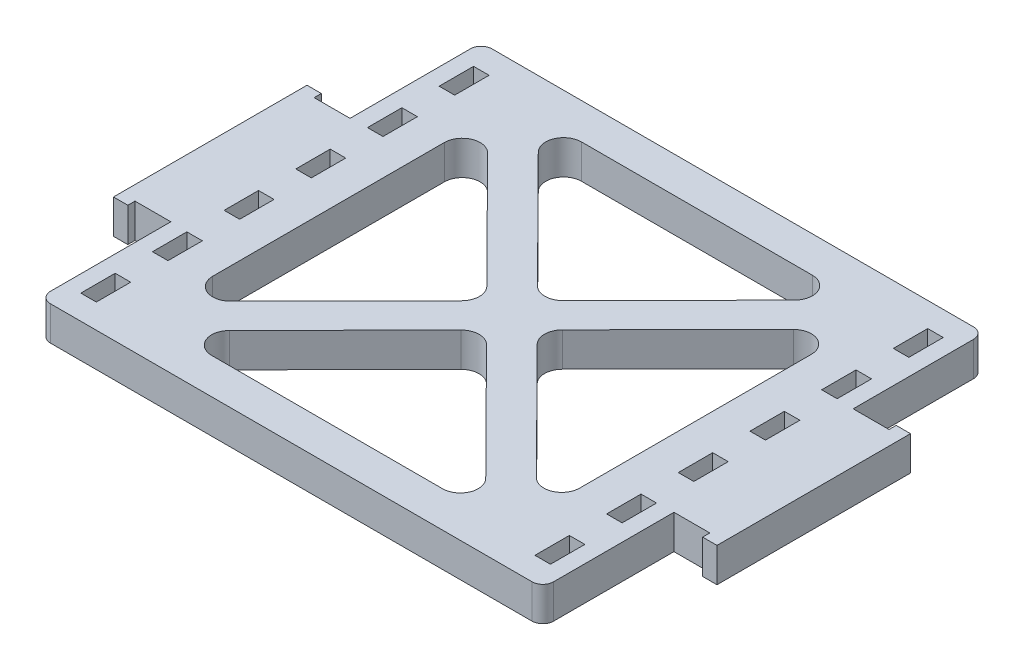
from build123d import *

# Parameters (mm, degrees)
BOSS_EXTRUDE1_DEPTH = 3.0226
SKETCH4_W           = 2.75
SKETCH4_H           = 6.096
CUT_EXTRUDE2_DEPTH  = 6.0452
SKETCH5_W           = 2.54
SKETCH5_H           = 34.29
BOSS_EXTRUDE2_DEPTH = 6.0452
CUT_EXTRUDE3_DEPTH  = 67.523123709
FILLET1_R           = 3.175
FILLET2_R           = 1.905


with BuildPart() as part:
    # Sketch1 → Boss-Extrude1 (new, symmetric)
    with BuildSketch(Plane(origin=(0, 0, 0), x_dir=(1, 0, 0), z_dir=(0, 1, 0))):
        Polygon((44.577, 39.116), (-44.577, 39.116), (-44.577, 15.875), (-50.927, 15.875), (-50.927, -15.875), (-44.577, -15.875), (-44.577, -39.116), (44.577, -39.116), (44.577, -15.875), (50.927, -15.875), (50.927, 15.875), (44.577, 15.875), align=None)
    extrude(amount=BOSS_EXTRUDE1_DEPTH, both=True)

    # Sketch4 → Cut-Extrude2 (cut)
    with BuildSketch(Plane(origin=(0, 3.0226, 0), x_dir=(1, 0, 0), z_dir=(0, 1, 0))):
        with Locations((-40.237, -31.75)):
            Rectangle(SKETCH4_W, SKETCH4_H)
        with Locations((-40.237, -19.05)):
            Rectangle(SKETCH4_W, SKETCH4_H)
        with Locations((-40.237, -6.35)):
            Rectangle(SKETCH4_W, SKETCH4_H)
        with Locations((-40.237, 6.35)):
            Rectangle(SKETCH4_W, SKETCH4_H)
        with Locations((-40.237, 19.05)):
            Rectangle(SKETCH4_W, SKETCH4_H)
        with Locations((-40.237, 31.75)):
            Rectangle(SKETCH4_W, SKETCH4_H)
        with Locations((40.237, 31.75)):
            Rectangle(SKETCH4_W, SKETCH4_H)
        with Locations((40.237, 19.05)):
            Rectangle(SKETCH4_W, SKETCH4_H)
        with Locations((40.237, 6.35)):
            Rectangle(SKETCH4_W, SKETCH4_H)
        with Locations((40.237, -6.35)):
            Rectangle(SKETCH4_W, SKETCH4_H)
        with Locations((40.237, -19.05)):
            Rectangle(SKETCH4_W, SKETCH4_H)
        with Locations((40.237, -31.75)):
            Rectangle(SKETCH4_W, SKETCH4_H)
    extrude(amount=-CUT_EXTRUDE2_DEPTH, mode=Mode.SUBTRACT)

    # Sketch5 → Boss-Extrude2 (add)
    with BuildSketch(Plane(origin=(0, 3.0226, 0), x_dir=(1, 0, 0), z_dir=(0, 1, 0))):
        with Locations((-52.197, 0)):
            Rectangle(SKETCH5_W, SKETCH5_H)
        with Locations((52.197, 0)):
            Rectangle(SKETCH5_W, SKETCH5_H)
    extrude(amount=-BOSS_EXTRUDE2_DEPTH)

    # Sketch6 → Cut-Extrude3 (cut, through all)
    with BuildSketch(Plane(origin=(0, 3.0226, 0), x_dir=(1, 0, 0), z_dir=(0, 1, 0))):
        Polygon((28.0776603, 32.766), (-28.0776603, 32.766), (0, 4.50482558), align=None)
        Polygon((-4.475573466, 0), (-32.512, 28.219671152), (-32.512, -28.219671152), align=None)
        Polygon((32.512, 28.219671152), (4.475573466, 0), (32.512, -28.219671152), align=None)
        Polygon((28.0776603, -32.766), (0, -4.50482558), (-28.0776603, -32.766), align=None)
    extrude(amount=-CUT_EXTRUDE3_DEPTH, mode=Mode.SUBTRACT)

    # Fillet1
    fillet1_edges = [part.edges().sort_by_distance(p)[0] for p in [
        (28.0776603, 0, -32.766),
        (-28.0776603, 0, -32.766),
        (0, 0, -4.50482558),
        (-32.512, 0, -28.219671152),
        (-4.475573466, 0, 0),
        (-32.512, 0, 28.219671152),
        (-28.0776603, 0, 32.766),
        (0, 0, 4.50482558),
        (28.0776603, 0, 32.766),
        (4.475573466, 0, 0),
        (32.512, 0, -28.219671152),
        (32.512, 0, 28.219671152),
    ]]
    fillet(fillet1_edges, radius=FILLET1_R)

    # Fillet2
    fillet2_edges = [part.edges().sort_by_distance(p)[0] for p in [
        (44.577, 0, 39.116),
        (44.577, 0, -39.116),
        (-44.577, 0, 39.116),
        (-44.577, 0, -39.116),
    ]]
    fillet(fillet2_edges, radius=FILLET2_R)


solid = part.part
